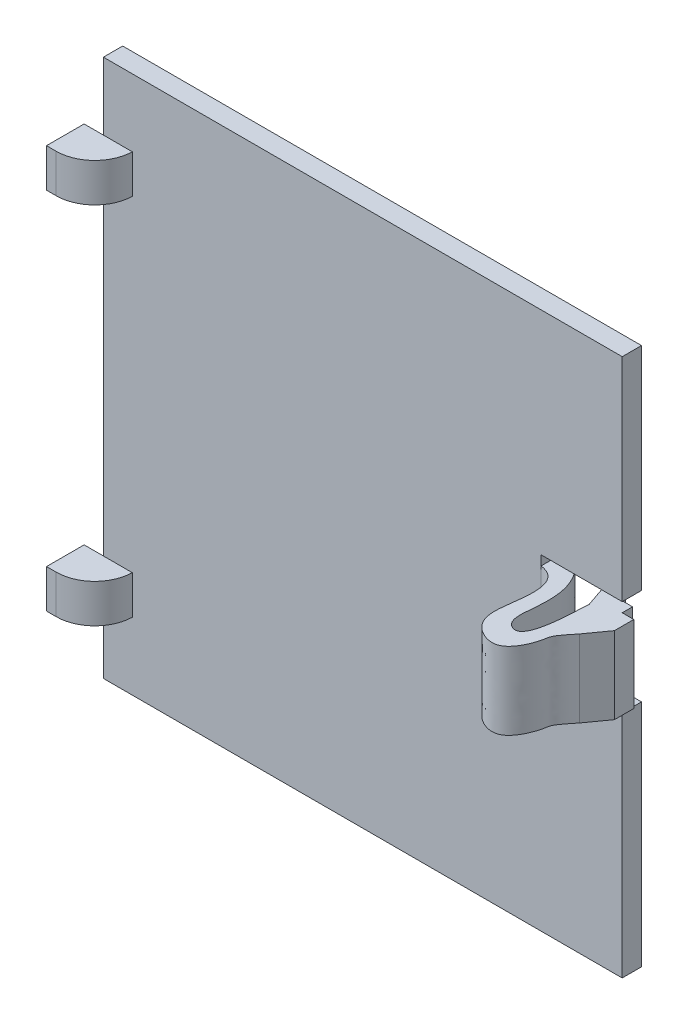
from build123d import *

# Parameters (mm, degrees)
ESQUISSE1_W             = 53.8
ESQUISSE1_H             = 55.8
BOSS_EXTRU_1_DEPTH      = 2
ESQUISSE3_W             = 5
ESQUISSE3_H             = 4
BOSS_EXTRU_2_DEPTH      = 3.9
CONG_1_R                = 4
ESQUISSE4_W             = 8.412600453
ESQUISSE4_H             = 10
ENL_V_MAT_EXTRU_1_DEPTH = 7.8
BOSS_EXTRU_3_START      = 1
BOSS_EXTRU_3_DEPTH      = 8


with BuildPart() as part:
    # Esquisse1 → Boss.-Extru.1 (new body)
    with BuildSketch(Plane.XY):
        with Locations((26.9, 27.9)):
            Rectangle(ESQUISSE1_W, ESQUISSE1_H)
    extrude(amount=BOSS_EXTRU_1_DEPTH)

    # Esquisse3 → Boss.-Extru.2 (add)
    with BuildSketch(Plane.XY.offset(2)):
        with Locations((0.5, 9)):
            Rectangle(ESQUISSE3_W, ESQUISSE3_H)
        with Locations((0.5, 46.8)):
            Rectangle(ESQUISSE3_W, ESQUISSE3_H)
    extrude(amount=BOSS_EXTRU_2_DEPTH)

    # Congé1
    # the kernel refuses this fillet: 4 mm, written as the material it takes off along each edge
    with BuildSketch(Plane(origin=(3, 58.796874512, 5.9), x_dir=(0, 0, -1), z_dir=(0, -1, 0)), Plane(origin=(3, 20.996874512, 5.9), x_dir=(0, 0, -1), z_dir=(0, -1, 0))) as cong_1_piece_1:
        with BuildLine():
            CenterArc((4, -3.998749805), CONG_1_R, 91.432543738, 88.567456262)
            Line((0, -3.998749805), (-0.08, -3.998749805))
            Line((-0.08, -3.998749805), (-0.08, 0))
            Line((-0.08, 0), (0, 0.08))
            ThreePointArc((0, 0.08), (1.95, 0.08), (3.898, 0.079974996))
            Line((3.898, 0.079974996), (3.9, 0))
        make_face()
    extrude(amount=23.993749023, mode=Mode.SUBTRACT)

    # Esquisse4 → Enlèv. mat.-Extru.1 (cut)
    with BuildSketch(Plane.XY.offset(2)):
        with Locations((49.593699774, 28.8)):
            Rectangle(ESQUISSE4_W, ESQUISSE4_H)
    extrude(amount=-ENL_V_MAT_EXTRU_1_DEPTH, mode=Mode.SUBTRACT)

    # Esquisse5 → Boss.-Extru.3 (add)
    with BuildSketch(Plane.XZ.offset(-33.8).offset(BOSS_EXTRU_3_START)):
        with BuildLine():
            Line((52.116537942, 0.927515673), (52.116537942, 0))
            Line((52.116537942, 0), (50.313981281, 0))
            Line((50.313981281, 0), (51.336356936, 2.967308385))
            add(Edge.make_bspline(
                [(45.387399547, 0), (46.455010673, 0.030774957), (47.125595065, -0.021344745), (48.899614795, 2.480533697), (48.957306387, 5.368692409), (48.491359116, 8.602707598), (50.081924854, 9.3139155), (51.361168313, 7.44142707), (51.2508337, 3.223878094), (51.336356936, 2.967308385)],
                knots=[0, 0, 0, 0, 0.100124677, 0.177204474, 0.427983887, 0.5870082, 0.626058964, 0.727290756, 1, 1, 1, 1], degree=3))
            Line((45.387399547, 0), (45.387399547, 2))
            add(Edge.make_bspline(
                [(45.387399547, 2), (47.571691044, 2.281668527), (47.414765021, 6.03590405), (46.588181158, 10.356210638), (50.843729596, 12.311121356), (52.448069251, 7.895489544), (52.08083827, 7.808250706), (53.488596921, 6.108354647)],
                knots=[0, 0, 0, 0, 0.293067652, 0.50878028, 0.665230689, 0.849911902, 1, 1, 1, 1], degree=3))
            Line((53.488596921, 6.108354647), (55, 4))
            Line((55, 4), (55, 2))
            Line((55, 2), (53.8, 2))
            Line((53.8, 2), (53.8, 0.927515673))
            Line((53.8, 0.927515673), (52.116537942, 0.927515673))
        make_face()
    extrude(amount=BOSS_EXTRU_3_DEPTH)


solid = part.part
